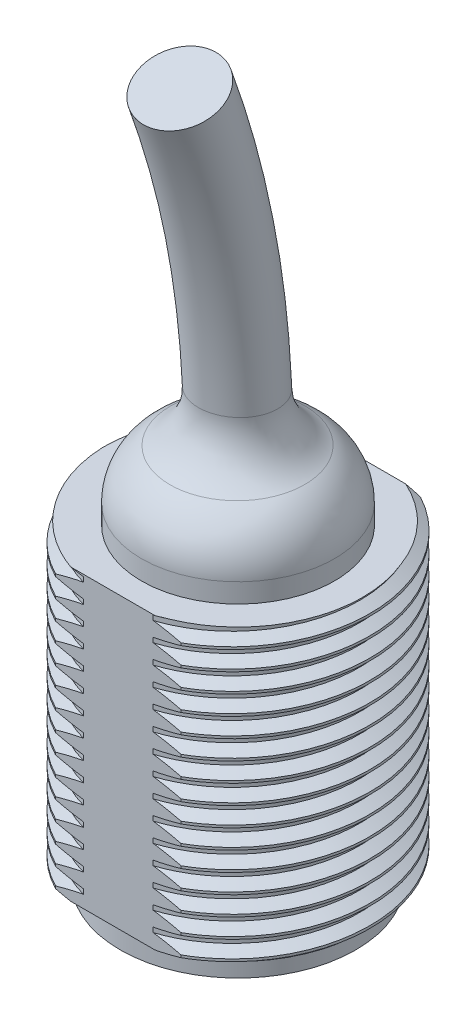
from build123d import *

# Parameters (mm, degrees)
SKETCH1_R               = 7
BODY_DEPTH              = 15
SKETCH8_R               = 6.1
SOCKETLIP_DEPTH         = 1
SKETCH9_R               = 5
BOSS_EXTRUDE3_DEPTH     = 4
FILLET1_R               = 3
SKETCH10_R              = 2
REVOLVE1_ANGLE          = 20
FILLET2_R               = 3
SKETCH11_R              = 5.1
CUT_EXTRUDE1_DEPTH      = 15.4
SKETCH12_R              = 3.05
BOSS_EXTRUDE4_DEPTH     = 10.7
SKETCH13_W              = 2.65
SKETCH13_H              = 2.6
CUT_EXTRUDE2_DEPTH      = 15.4
THREAD1_PITCH           = 1
CUT_EXTRUDE3_DEPTH      = 40.060335654
CUT_EXTRUDE3_DEPTH_BACK = 40.060335654
SKETCH14_W              = 20
SKETCH14_H              = 5


with BuildPart() as part:
    # Sketch1 → body (new body)
    with BuildSketch(Plane(origin=(0, 0, 0), x_dir=(1, 0, 0), z_dir=(0, 1, 0))):
        with Locations(Location((0, 0, 0), (0, 0, 270))):
            Circle(SKETCH1_R)
    extrude(amount=BODY_DEPTH)

    # Sketch8 → socketLip (add)
    with BuildSketch(Plane.XZ):
        with Locations(Location((0, 0, 0), (0, 0, 90))):
            Circle(SKETCH8_R)
    extrude(amount=SOCKETLIP_DEPTH)

    # Sketch9 → Boss-Extrude3 (add)
    with BuildSketch(Plane(origin=(0, 15, 0), x_dir=(1, 0, 0), z_dir=(0, 1, 0))):
        with Locations(Location((0, 0, 0), (0, 0, 270))):
            Circle(SKETCH9_R)
    extrude(amount=BOSS_EXTRUDE3_DEPTH)

    # Fillet1
    fillet1_edges = [part.edges().sort_by_distance(p)[0] for p in [
        (0, 19, -5),
    ]]
    fillet(fillet1_edges, radius=FILLET1_R)

    # Sketch10 → Revolve1 (revolve)
    with BuildSketch(Plane(origin=(0, 19, 0), x_dir=(1, 0, 0), z_dir=(0, 1, 0))):
        Circle(SKETCH10_R)
    revolve(axis=Axis((11.77400734, 19, 50), (1, 0, 0)), revolution_arc=REVOLVE1_ANGLE)

    # Fillet2
    fillet2_edges = [part.edges().sort_by_distance(p)[0] for p in [
        (1.414213562, 19, 1.414213562),
    ]]
    fillet(fillet2_edges, radius=FILLET2_R)

    # Sketch11 → Cut-Extrude1 (cut)
    with BuildSketch(Plane.XZ.offset(1)):
        with Locations(Location((0, 0, 0), (0, 0, 270))):
            Circle(SKETCH11_R)
    extrude(amount=-CUT_EXTRUDE1_DEPTH, mode=Mode.SUBTRACT)

    # Sketch12 → Boss-Extrude4 (add)
    with BuildSketch(Plane.XZ.offset(-14.4)):
        with Locations(Location((0, 0, 0), (0, 0, 270))):
            Circle(SKETCH12_R)
    extrude(amount=BOSS_EXTRUDE4_DEPTH)

    # Sketch13 → Cut-Extrude2 (cut)
    with BuildSketch(Plane.XZ.offset(1)):
        with Locations((4.375, 0)):
            Rectangle(SKETCH13_W, SKETCH13_H)
    extrude(amount=-CUT_EXTRUDE2_DEPTH, mode=Mode.SUBTRACT)

    # Thread1: the profile of Thread Profile1 profile screwed along a right-hand helix of 20 turns, 8 arcs to a turn; built about Z, then put on its axis
    thread1_z = Axis((0, 0, 0), (0, 0, 1))
    thread1_corners = [(7.0003, 0, -0.000173205), (7.0003, 0, 0.875173202), (6.458734125, 0, 0.562499999), (6.458734125, 0, 0.312499999)]
    with BuildLine(mode=Mode.PRIVATE) as thread1_profile:
        Line(thread1_corners[0], thread1_corners[1])
        Line(thread1_corners[1], thread1_corners[2])
        Line(thread1_corners[2], thread1_corners[3])
        Line(thread1_corners[3], thread1_corners[0])
    thread1_cap = Face(thread1_profile.wire())
    thread1_turn_angles = [0, 22.5, 45, 67.5, 90, 112.5, 135, 157.5, 180, 202.5, 225, 247.5, 270, 292.5, 315, 337.5, 360]
    thread1_turn_weights = [1, 0.9238795325112867, 1, 0.9238795325112867, 1, 0.9238795325112867, 1, 0.9238795325112867, 1, 0.9238795325112867, 1, 0.9238795325112867, 1, 0.9238795325112867, 1, 0.9238795325112867, 1]
    thread1_turn_rails = [Edge.make_bspline([Vector(p[0], p[1], 0).rotate(thread1_z, thread1_turn_angles[k]) / thread1_turn_weights[k] + Vector(0, 0, p[2] + THREAD1_PITCH * thread1_turn_angles[k] / 360) for k in range(17)], [0, 0, 0, 1, 1, 2, 2, 3, 3, 4, 4, 5, 5, 6, 6, 7, 7, 8, 8, 8], 2, thread1_turn_weights) for p in thread1_corners]
    thread1_turn_sides = [Face.make_surface_from_curves(thread1_turn_rails[p[0]], thread1_turn_rails[p[1]]) for p in [(0, 1), (1, 2), (2, 3), (3, 0)]]
    thread1 = Plane(origin=(0, 17, 0), x_dir=(-1, 0, 0), z_dir=(0, -1, 0)) * Solid(Shell([*[p.moved(Location((0, 0, THREAD1_PITCH * i))) for i in range(20) for p in thread1_turn_sides], thread1_cap, thread1_cap.rotate(thread1_z, 7200).moved(Location((0, 0, THREAD1_PITCH * 7200 / 360)))]))
    add(thread1, mode=Mode.SUBTRACT)

    # Sketch14 → Cut-Extrude3 (cut, two sides: drawn at the far end of the back side and taken through both)
    with BuildSketch(Plane.XZ.offset(1).offset(-CUT_EXTRUDE3_DEPTH_BACK)):
        with Locations((0, 8.7)):
            Rectangle(SKETCH14_W, SKETCH14_H)
        with Locations((0, -8.7)):
            Rectangle(SKETCH14_W, SKETCH14_H)
    extrude(amount=CUT_EXTRUDE3_DEPTH + CUT_EXTRUDE3_DEPTH_BACK, mode=Mode.SUBTRACT)


solid = part.part
